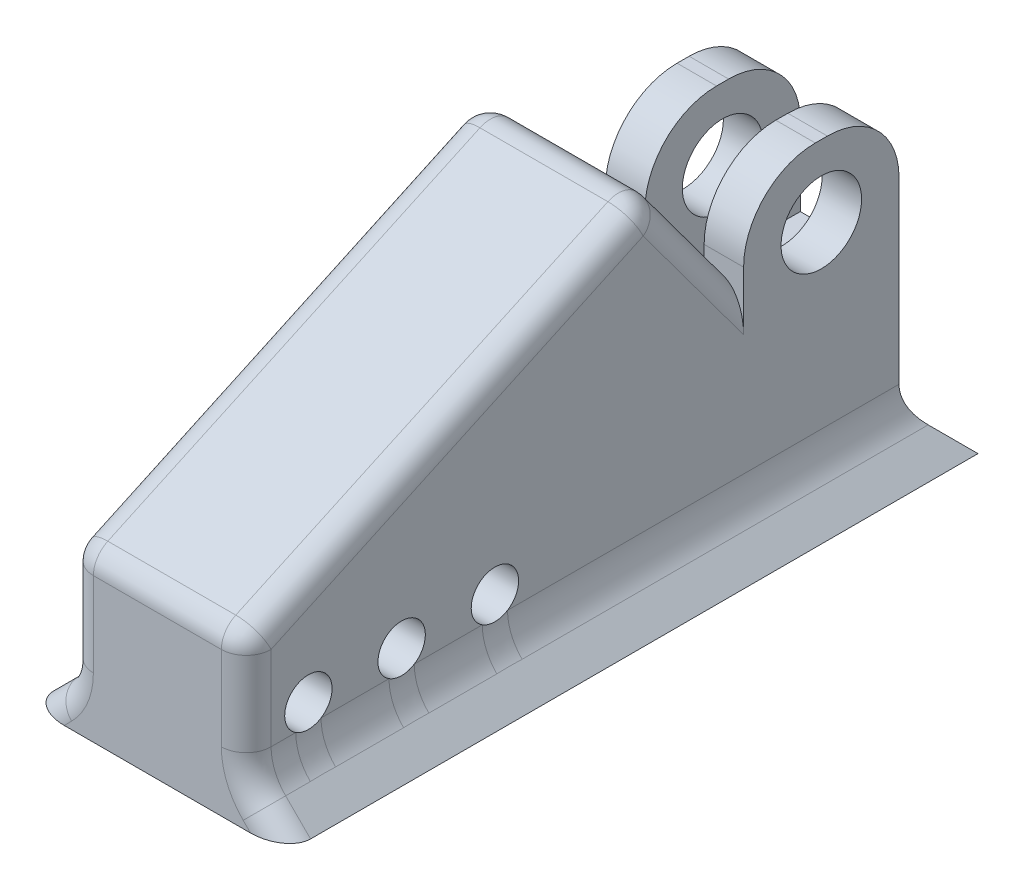
from build123d import *

# Parameters (mm, degrees)
SKETCH1_W                       = 28.58
SKETCH1_H                       = 50
BOSS_EXTRUDE1_DEPTH             = 12.5
SKETCH2_W                       = 9.53
SKETCH2_H                       = 24.225
SKETCH2_W_2                     = 6.35
CUT_EXTRUDE1_DEPTH              = 39.134028111
FILLET1_R                       = 11.53
SKETCH3_R                       = 6.477
CUT_EXTRUDE2_DEPTH              = 40.975822693
BOSS_EXTRUDE2_DEPTH             = 28.58
SKETCH5_W                       = 28.58
SKETCH5_H                       = 25.775
BOSS_EXTRUDE3_DEPTH             = 80
CUT_EXTRUDE3_DEPTH              = 100.990331533
CUT_EXTRUDE3_DEPTH_BACK         = 100.990331533
SKETCH6_R                       = 3.81
BOSS_EXTRUDE4_REACH             = 110.877
BOSS_EXTRUDE4_DIRECTION_2_REACH = 110.877
TROUS_DE_CENTRAGE_5_0MM1_D      = 5
TROUS_DE_CENTRAGE_5_0MM1_DEPTH  = 10
TROUS_DE_CENTRAGE_5_0MM1_TIP    = 1.502151548
BOSS_EXTRU_1_REACH              = 103.987
FILLET2_R                       = 8
FILLET4_R                       = 4


with BuildPart() as part:
    # Sketch1 → Boss-Extrude1 (new, symmetric)
    with BuildSketch(Plane.XY):
        Rectangle(SKETCH1_W, SKETCH1_H)
    extrude(amount=BOSS_EXTRUDE1_DEPTH, both=True)

    # Sketch2 → Cut-Extrude1 (cut, through all)
    with BuildSketch(Plane(origin=(0, 0, 12.5), x_dir=(-1, 0, 0), z_dir=(0, 0, 1))):
        with Locations((-3.175, -12.8875)):
            Rectangle(SKETCH2_W, SKETCH2_H)
        with Locations((11.115, -12.8875)):
            Rectangle(SKETCH2_W_2, SKETCH2_H)
    extrude(amount=-CUT_EXTRUDE1_DEPTH, mode=Mode.SUBTRACT)

    # Fillet1
    fillet1_edges = [part.edges().sort_by_distance(p)[0] for p in [
        (-4.765, 25, -12.5),
        (-4.765, 25, 12.5),
        (11.115, 25, -12.5),
        (11.115, 25, 12.5),
    ]]
    fillet(fillet1_edges, radius=FILLET1_R)

    # Sketch3 → Cut-Extrude2 (cut, through all)
    with BuildSketch(Plane(origin=(14.29, 0, 0), x_dir=(0, 0, -1), z_dir=(1, 0, 0))):
        with Locations(Location((0, 13.47, 0), (0, 0, 270))):
            Circle(SKETCH3_R)
    extrude(amount=-CUT_EXTRUDE2_DEPTH, mode=Mode.SUBTRACT)

    # Sketch4 → Boss-Extrude2 (add)
    with BuildSketch(Plane(origin=(14.29, 0, 0), x_dir=(0, 0, -1), z_dir=(1, 0, 0))):
        Polygon((18.85, -25), (12.5, -18.65), (12.5, -25), align=None)
    extrude(amount=-BOSS_EXTRUDE2_DEPTH)

    # Sketch5 → Boss-Extrude3 (add)
    with BuildSketch(Plane.XY.offset(12.5)):
        with Locations((0, -12.1125)):
            Rectangle(SKETCH5_W, SKETCH5_H)
    extrude(amount=BOSS_EXTRUDE3_DEPTH)

    # Sketch6 → Cut-Extrude3 (cut, two sides: drawn at the far end of the back side and taken through both)
    with BuildSketch(Plane(origin=(14.29, 0, 0), x_dir=(0, 0, -1), z_dir=(1, 0, 0)).offset(-CUT_EXTRUDE3_DEPTH_BACK)):
        with Locations((-82.5, -12.1125)):
            Circle(SKETCH6_R)
        with Locations((-67.5, -12.1125)):
            Circle(SKETCH6_R)
        with Locations((-52.5, -12.1125)):
            Circle(SKETCH6_R)
    extrude(amount=CUT_EXTRUDE3_DEPTH + CUT_EXTRUDE3_DEPTH_BACK, mode=Mode.SUBTRACT)

    # Boss-Extrude4: up to this face of the body (flat: up to its plane)
    boss_extrude4_end = Plane(part.part.faces().sort_by_distance((0, -12.1125, 92.5))[0])
    # Sketch7 → Boss-Extrude4 (add, up to the picked face)
    with BuildSketch(Plane(origin=(0, 0, -12.5), x_dir=(-1, 0, 0), z_dir=(0, 0, -1)), mode=Mode.PRIVATE) as boss_extrude4_sk1:
        Polygon((-14.29, -25), (-20.64, -25), (-14.29, -18.65), align=None)
    boss_extrude4_tool1 = split(extrude(boss_extrude4_sk1.sketch, amount=-BOSS_EXTRUDE4_REACH, mode=Mode.PRIVATE), bisect_by=boss_extrude4_end, keep=Keep.BOTH, mode=Mode.PRIVATE)
    boss_extrude4 = boss_extrude4_tool1.solids().sort_by(Axis((16.406667, -22.883333, -12.5), (0, 0, 1)))[0]
    add(boss_extrude4)

    # Boss-Extrude4 direction 2: up to this face of the body (flat: up to its plane)
    boss_extrude4_direction_2_end = Plane(part.part.faces().sort_by_distance((0, -21.825, -15.675))[0])
    # Sketch7 → Boss-Extrude4 direction 2 (add, up to the picked face)
    with BuildSketch(Plane(origin=(0, 0, -12.5), x_dir=(-1, 0, 0), z_dir=(0, 0, -1)), mode=Mode.PRIVATE) as boss_extrude4_direction_2_sk1:
        Polygon((-14.29, -25), (-20.64, -25), (-14.29, -18.65), align=None)
    boss_extrude4_direction_2_tool1 = split(extrude(boss_extrude4_direction_2_sk1.sketch, amount=BOSS_EXTRUDE4_DIRECTION_2_REACH, mode=Mode.PRIVATE), bisect_by=boss_extrude4_direction_2_end, keep=Keep.BOTH, mode=Mode.PRIVATE)
    boss_extrude4_direction_2 = boss_extrude4_direction_2_tool1.solids().sort_by(Axis((16.406667, -22.883333, -12.5), (0, 0, -1)))[0]
    add(boss_extrude4_direction_2)

    # Mirror2: Boss-Extrude4, Boss-Extrude4 direction 2 across plane
    add(boss_extrude4.mirror(Plane(origin=(0, 0, 0), x_dir=(0, 0, 1), z_dir=(1, 0, 0))))
    add(boss_extrude4_direction_2.mirror(Plane(origin=(0, 0, 0), x_dir=(0, 0, 1), z_dir=(1, 0, 0))))

    # Trous de centrage Ø5.0mm1
    with Locations(Plane(origin=(0, -25, 0), x_dir=(-1, 0, 0), z_dir=(0, -1, 0))):
        with Locations((-7.5, 0.534345417), (7.5, 0.534345417), (7.5, -14.465654583), (-7.5, -14.465654583), (-7.5, -29.465654583), (7.5, -29.465654583), (7.5, -44.465654583), (-7.5, -44.465654583)):
            Hole(TROUS_DE_CENTRAGE_5_0MM1_D / 2, depth=TROUS_DE_CENTRAGE_5_0MM1_DEPTH)
            with Locations((0, 0, -(TROUS_DE_CENTRAGE_5_0MM1_DEPTH + TROUS_DE_CENTRAGE_5_0MM1_TIP / 2))):  # 118° drill point
                Cone(0, TROUS_DE_CENTRAGE_5_0MM1_D / 2, TROUS_DE_CENTRAGE_5_0MM1_TIP, mode=Mode.SUBTRACT)

    # Boss.-Extru.1: up to this face of the body (flat: up to its plane)
    boss_extru_1_end = Plane(part.part.faces().sort_by_distance((-14.29, -8.709219679, 38.022768873))[0])
    # Esquisse1 → Boss.-Extru.1 (add, up to the picked face)
    with BuildSketch(Plane(origin=(14.29, 0, 0), x_dir=(0, 0, -1), z_dir=(1, 0, 0)), mode=Mode.PRIVATE) as boss_extru_1_sk1:
        Polygon((-27.370569669, 30.871421515), (-12.5, 10.775), (-12.5, 0.775), (-92.5, 0.775), align=None)
    boss_extru_1_tool1 = split(extrude(boss_extru_1_sk1.sketch, amount=-BOSS_EXTRU_1_REACH, mode=Mode.PRIVATE), bisect_by=boss_extru_1_end, keep=Keep.BOTH, mode=Mode.PRIVATE)
    add(boss_extru_1_tool1.solids().sort_by(Axis((14.29, 11.001039, 42.572336), (-1, 0, 0)))[0])

    # Fillet2
    fillet2_edges = [part.edges().sort_by_distance(p)[0] for p in [
        (14.29, -18.65, 40),
        (-14.29, -18.65, 40),
        (0, -18.65, -12.5),
    ]]
    fillet(fillet2_edges, radius=FILLET2_R)

    # Fillet4
    fillet4_edges = [part.edges().sort_by_distance(p)[0] for p in [
        (18.636572875, -22.996572875, 92.5),
        (-18.636572875, -22.996572875, 92.5),
        (0, 30.871421515, 27.370569669),
        (14.29, 20.823210758, 19.935284834),
        (14.29, 15.823210758, 59.935284834),
        (-14.29, 15.823210758, 59.935284834),
        (-14.29, 20.823210758, 19.935284834),
        (14.29, -7.280645751, 92.5),
        (-14.89896374, -18.39775896, 92.5),
        (14.89896374, -18.39775896, 92.5),
        (-14.29, 0.775, 0),
        (-14.29, -7.280645751, 92.5),
        (0, 0.775, 92.5),
    ]]
    fillet(fillet4_edges, radius=FILLET4_R)


solid = part.part
